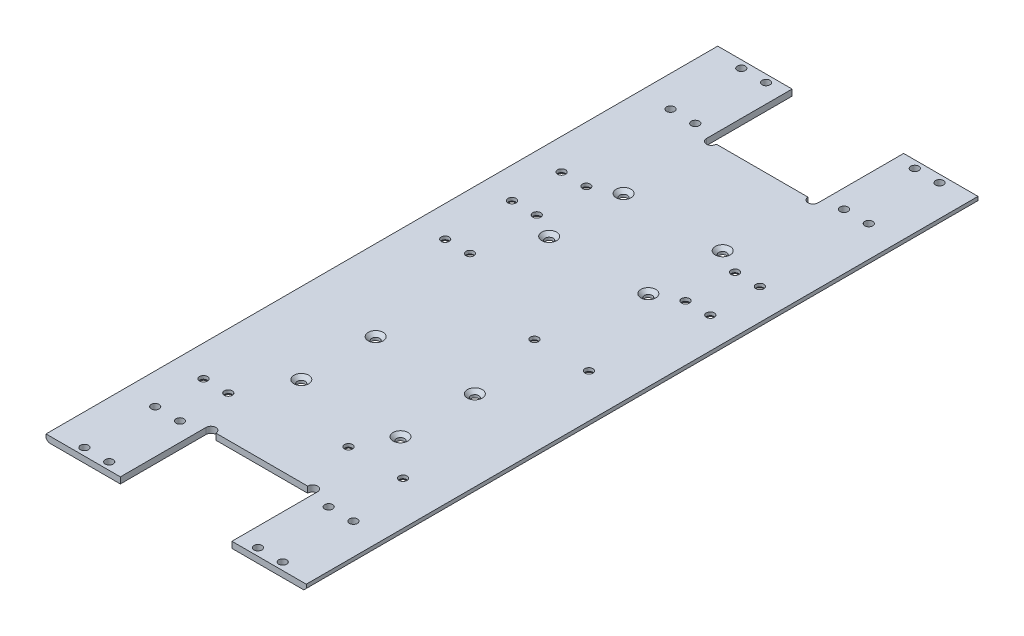
from build123d import *

# Parameters (mm, degrees)
SKETCH_1_W          = 105
SKETCH_1_H          = 271
EXTRUDE_1_DEPTH     = 2.5
SKETCH_2_R          = 1.6
CUT_EXTRUDE_1_DEPTH = 10
CHAMFER_4_SIZE      = 1.4
CHAMFER_5_SIZE      = 1
CUT_EXTRUDE_2_DEPTH = 10
SKETCH_6_R          = 1.6
CUT_EXTRUDE_3_DEPTH = 10
SKETCH_7_R          = 1.6
CUT_EXTRUDE_4_DEPTH = 10
SKETCH_8_R          = 1.6
CUT_EXTRUDE_5_DEPTH = 10
SKETCH_9_R          = 2
CUT_EXTRUDE_6_DEPTH = 10
CHAMFER_3_SIZE      = 1.2


with BuildPart() as part:
    # 草图1 → 凸台-拉伸1 (new body)
    with BuildSketch(Plane(origin=(0, 0, 0), x_dir=(1, 0, 0), z_dir=(0, 1, 0))):
        Rectangle(SKETCH_1_W, SKETCH_1_H)
    extrude(amount=EXTRUDE_1_DEPTH)

    # 草图2 → 切除-拉伸1 (cut)
    with BuildSketch(Plane(origin=(0, 2.5, 0), x_dir=(1, 0, 0), z_dir=(0, 1, 0))):
        with Locations((35, -3.95)):
            Circle(SKETCH_2_R)
        with Locations((13.000000181, -3.95)):
            Circle(SKETCH_2_R)
        with Locations((35, -78.95)):
            Circle(SKETCH_2_R)
        with Locations((13.000000181, -78.95)):
            Circle(SKETCH_2_R)
        with Locations((20, -35)):
            Circle(SKETCH_2_R)
        with Locations((-20, -35)):
            Circle(SKETCH_2_R)
        with Locations((20, -65)):
            Circle(SKETCH_2_R)
        with Locations((-20, -65)):
            Circle(SKETCH_2_R)
        with Locations((-20, 35)):
            Circle(SKETCH_2_R)
        with Locations((20, 35)):
            Circle(SKETCH_2_R)
        with Locations((-20, 65)):
            Circle(SKETCH_2_R)
        with Locations((20, 65)):
            Circle(SKETCH_2_R)
    extrude(amount=-CUT_EXTRUDE_1_DEPTH, mode=Mode.SUBTRACT)

    # 倒角4
    chamfer_4_edges = [part.edges().sort_by_distance(p)[0] for p in [
        (-21.6, 2.5, 65),
        (-21.6, 2.5, 35),
        (18.4, 2.5, 65),
        (18.4, 2.5, 35),
        (-21.6, 2.5, -35),
        (-21.6, 2.5, -65),
        (18.4, 2.5, -35),
        (18.4, 2.5, -65),
    ]]
    chamfer(chamfer_4_edges, length=CHAMFER_4_SIZE)

    # 倒角5
    chamfer_5_edges = [part.edges().sort_by_distance(p)[0] for p in [
        (52.5, 0, 0),
        (-52.5, 0, 0),
    ]]
    chamfer(chamfer_5_edges, length=CHAMFER_5_SIZE)

    # 草图4 → 切除-拉伸2 (cut)
    with BuildSketch(Plane.XZ):
        Polygon((0, 100.95), (22.5, 100.95), (22.5, 135.5), (-22.5, 135.5), (-22.5, 100.95), align=None)
        Polygon((-22.5, -100.95), (0, -100.95), (22.5, -100.95), (22.5, -135.5), (-22.5, -135.5), align=None)
    extrude(amount=-CUT_EXTRUDE_2_DEPTH, mode=Mode.SUBTRACT)

    # 草图6 → 切除-拉伸3 (cut)
    with BuildSketch(Plane.XZ):
        with Locations((-40, 132.5)):
            Circle(SKETCH_6_R)
        with Locations((-30, 132.5)):
            Circle(SKETCH_6_R)
        with Locations((-30, 103.95)):
            Circle(SKETCH_6_R)
        with Locations((-40, 103.95)):
            Circle(SKETCH_6_R)
        with Locations((40, 103.95)):
            Circle(SKETCH_6_R)
        with Locations((30, 103.95)):
            Circle(SKETCH_6_R)
        with Locations((30, 132.5)):
            Circle(SKETCH_6_R)
        with Locations((40, 132.5)):
            Circle(SKETCH_6_R)
        with Locations((40, -132.5)):
            Circle(SKETCH_6_R)
        with Locations((30, -132.5)):
            Circle(SKETCH_6_R)
        with Locations((30, -103.95)):
            Circle(SKETCH_6_R)
        with Locations((40, -103.95)):
            Circle(SKETCH_6_R)
        with Locations((-40, -103.95)):
            Circle(SKETCH_6_R)
        with Locations((-30, -103.95)):
            Circle(SKETCH_6_R)
        with Locations((-30, -132.5)):
            Circle(SKETCH_6_R)
        with Locations((-40, -132.5)):
            Circle(SKETCH_6_R)
    extrude(amount=-CUT_EXTRUDE_3_DEPTH, mode=Mode.SUBTRACT)

    # 草图7 → 切除-拉伸4 (cut)
    with BuildSketch(Plane(origin=(0, 2.5, 0), x_dir=(1, 0, 0), z_dir=(0, 1, 0))):
        with Locations((-40, 60)):
            Circle(SKETCH_7_R)
        with Locations((-30, 60)):
            Circle(SKETCH_7_R)
        with Locations((30, 60)):
            Circle(SKETCH_7_R)
        with Locations((40, 60)):
            Circle(SKETCH_7_R)
        with Locations((-40, 40)):
            Circle(SKETCH_7_R)
        with Locations((-30, 40)):
            Circle(SKETCH_7_R)
        with Locations((30, 40)):
            Circle(SKETCH_7_R)
        with Locations((40, 40)):
            Circle(SKETCH_7_R)
    extrude(amount=-CUT_EXTRUDE_4_DEPTH, mode=Mode.SUBTRACT)

    # 草图8 → 切除-拉伸5 (cut)
    with BuildSketch(Plane.XZ):
        with Locations((-40, 84.45)):
            Circle(SKETCH_8_R)
        with Locations((-30, 84.45)):
            Circle(SKETCH_8_R)
        with Locations((-40, -13.05)):
            Circle(SKETCH_8_R)
        with Locations((-30, -13.05)):
            Circle(SKETCH_8_R)
    extrude(amount=-CUT_EXTRUDE_5_DEPTH, mode=Mode.SUBTRACT)

    # 草图9 → 切除-拉伸6 (cut)
    with BuildSketch(Plane.XZ):
        with Locations((20.5, 100.95)):
            Circle(SKETCH_9_R)
        with Locations((-20.5, 100.95)):
            Circle(SKETCH_9_R)
        with Locations((-20.5, -100.95)):
            Circle(SKETCH_9_R)
        with Locations((20.5, -100.95)):
            Circle(SKETCH_9_R)
    extrude(amount=-CUT_EXTRUDE_6_DEPTH, mode=Mode.SUBTRACT)

    # 倒角3
    chamfer_3_edges = [part.edges().sort_by_distance(p)[0] for p in [
        (11.400000181, 0, 3.95),
        (33.4, 0, 3.95),
        (33.4, 0, 78.95),
        (11.400000181, 0, 78.95),
        (38.4, 0, -60),
        (28.4, 0, -60),
        (-31.6, 0, -60),
        (-41.6, 0, -60),
        (-31.6, 0, -13.05),
        (-41.6, 0, -13.05),
        (-31.6, 0, 84.45),
        (-41.6, 0, 84.45),
        (-41.6, 0, -40),
        (-31.6, 0, -40),
        (28.4, 0, -40),
        (38.4, 0, -40),
    ]]
    chamfer(chamfer_3_edges, length=CHAMFER_3_SIZE)


solid = part.part
